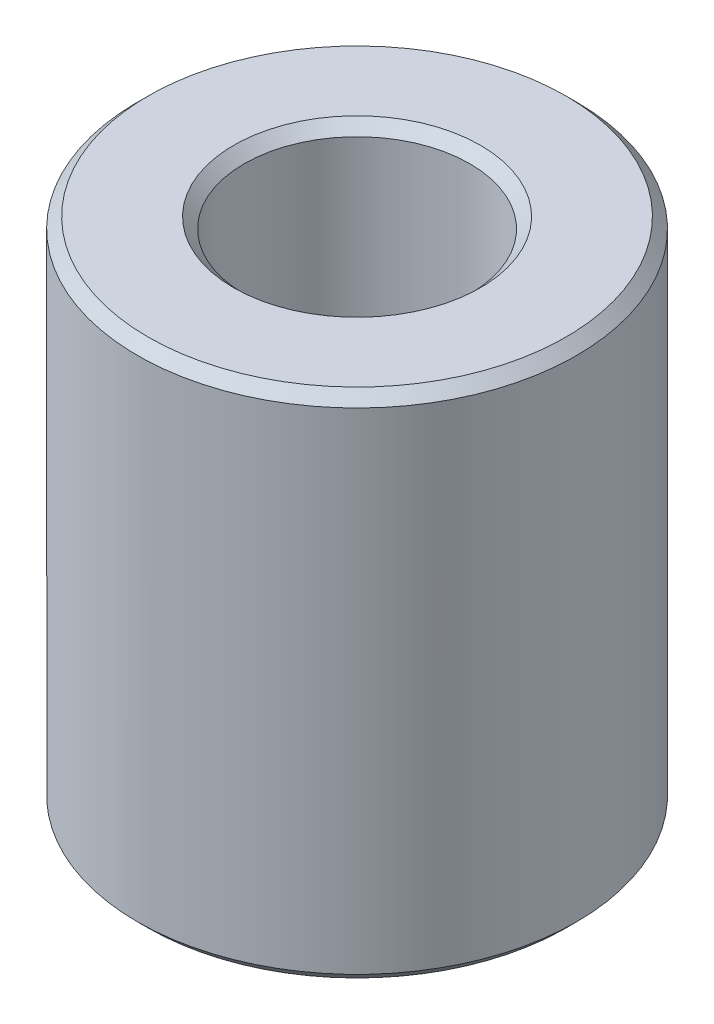
from build123d import *

# Parameters (mm, degrees)
SKETCH1_R           = 47.5
BOSS_EXTRUDE1_DEPTH = 110.73807217
SKETCH2_R           = 24.404907275
CUT_EXTRUDE1_DEPTH  = 130.519962276
CHAMFER1_SIZE       = 2.300814904


with BuildPart() as part:
    # Sketch1 → Boss-Extrude1 (new body)
    with BuildSketch(Plane(origin=(0, 0, 0), x_dir=(1, 0, 0), z_dir=(0, 1, 0))):
        Circle(SKETCH1_R)
    extrude(amount=BOSS_EXTRUDE1_DEPTH)

    # Sketch2 → Cut-Extrude1 (cut, through all)
    with BuildSketch(Plane(origin=(0, 0, 0), x_dir=(1, 0, 0), z_dir=(0, 1, 0))):
        Circle(SKETCH2_R)
    extrude(amount=CUT_EXTRUDE1_DEPTH, mode=Mode.SUBTRACT)

    # Chamfer1
    chamfer1_edges = [part.edges().sort_by_distance(p)[0] for p in [
        (-24.404907275, 110.73807217, 0),
        (-24.404907275, 0, 0),
        (-47.5, 0, 0),
        (-47.5, 110.73807217, 0),
    ]]
    chamfer(chamfer1_edges, length=CHAMFER1_SIZE)


solid = part.part
